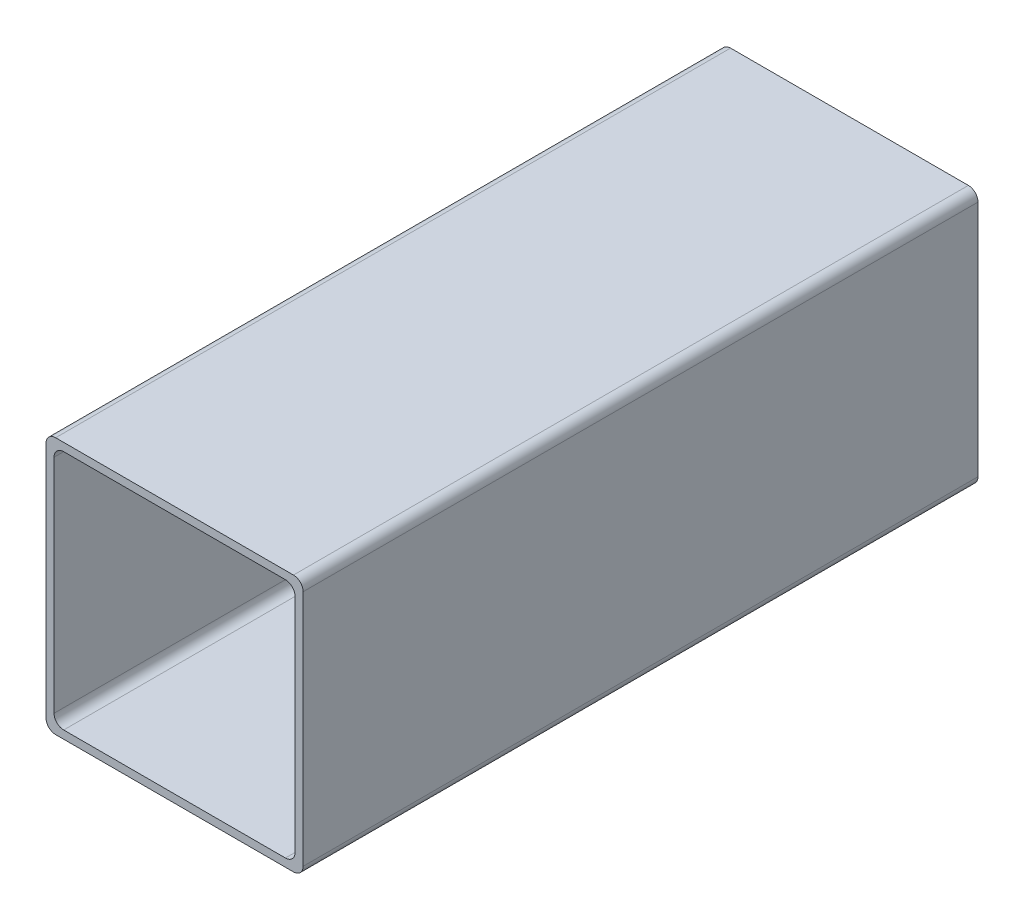
from build123d import *

# Parameters (mm, degrees)
SKETCH2_W           = 101.6
SKETCH2_H           = 101.6
BOSS_EXTRUDE1_DEPTH = 266.7
SKETCH3_W           = 95.25
SKETCH3_H           = 95.25
CUT_EXTRUDE1_DEPTH  = 266.7
FILLET3_R           = 3.81
FILLET4_R           = 3.81


with BuildPart() as part:
    # Sketch2 → Boss-Extrude1 (new body)
    with BuildSketch(Plane.XY):
        Rectangle(SKETCH2_W, SKETCH2_H)
    extrude(amount=BOSS_EXTRUDE1_DEPTH)

    # Sketch3 → Cut-Extrude1 (cut)
    with BuildSketch(Plane.XY.offset(266.7)):
        Rectangle(SKETCH3_W, SKETCH3_H)
    extrude(amount=-CUT_EXTRUDE1_DEPTH, mode=Mode.SUBTRACT)

    # Fillet3
    fillet3_edges = [part.edges().sort_by_distance(p)[0] for p in [
        (-47.625, -47.625, 133.35),
        (47.625, -47.625, 133.35),
        (47.625, 47.625, 133.35),
        (-47.625, 47.625, 133.35),
    ]]
    fillet(fillet3_edges, radius=FILLET3_R)

    # Fillet4
    fillet4_edges = [part.edges().sort_by_distance(p)[0] for p in [
        (50.8, -50.8, 133.35),
        (-50.8, -50.8, 133.35),
        (-50.8, 50.8, 133.35),
        (50.8, 50.8, 133.35),
    ]]
    fillet(fillet4_edges, radius=FILLET4_R)


solid = part.part
